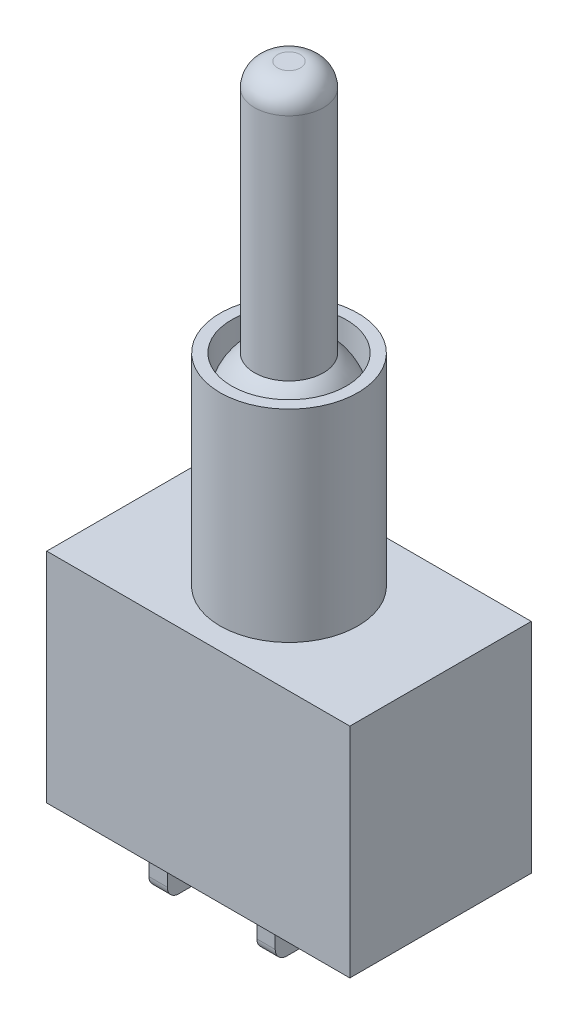
from build123d import *

# Parameters (mm, degrees)
SKETCH1_W           = 13.2
SKETCH1_H           = 7.9
BOSS_EXTRUDE1_DEPTH = 9.5
SKETCH2_R           = 3
BOSS_EXTRUDE2_DEPTH = 8.8
SKETCH4_R           = 2.5
CUT_EXTRUDE1_DEPTH  = 2
SKETCH5_R           = 1.5
BOSS_EXTRUDE3_DEPTH = 13
REVOLVE2_ANGLE      = 180
FILLET1_R           = 1
SKETCH6_W           = 0.8
SKETCH6_H           = 2
BOSS_EXTRUDE4_DEPTH = 4
SKETCH7_W           = 1
SKETCH7_H           = 2
CUT_EXTRUDE3_DEPTH  = 32.795951
FILLET3_R           = 0.5


with BuildPart() as part:
    # Sketch1 → Boss-Extrude1 (new body)
    with BuildSketch(Plane(origin=(0, 0, 0), x_dir=(1, 0, 0), z_dir=(0, 1, 0))):
        Rectangle(SKETCH1_W, SKETCH1_H)
    extrude(amount=BOSS_EXTRUDE1_DEPTH)

    # Sketch2 → Boss-Extrude2 (add)
    with BuildSketch(Plane(origin=(0, 9.5, 0), x_dir=(1, 0, 0), z_dir=(0, 1, 0))):
        with Locations(Location((0, 0, 0), (0, 0, 270))):
            Circle(SKETCH2_R)
    extrude(amount=BOSS_EXTRUDE2_DEPTH)

    # Sketch4 → Cut-Extrude1 (cut)
    with BuildSketch(Plane(origin=(0, 18.3, 0), x_dir=(1, 0, 0), z_dir=(0, 1, 0))):
        with Locations(Location((0, 0, 0), (0, 0, 270))):
            Circle(SKETCH4_R)
    extrude(amount=-CUT_EXTRUDE1_DEPTH, mode=Mode.SUBTRACT)

    # Sketch5 → Boss-Extrude3 (add)
    with BuildSketch(Plane(origin=(0, 16.3, 0), x_dir=(1, 0, 0), z_dir=(0, 1, 0))):
        with Locations(Location((0, 0, 0), (0, 0, 90))):
            Circle(SKETCH5_R)
    extrude(amount=BOSS_EXTRUDE3_DEPTH)

    # Sketch3 → Revolve2 (revolve)
    with BuildSketch(Plane(origin=(0, 16.3, 0), x_dir=(1, 0, 0), z_dir=(0, 1, 0))):
        with BuildLine():
            Line((0, -2.5), (0, 2.5))
            ThreePointArc((0, 2.5), (-2.5, 0), (0, -2.5))
        make_face()
    revolve(axis=Axis((0, 16.3, 3), (0, 0, -1)), revolution_arc=REVOLVE2_ANGLE)

    # Fillet1
    fillet1_edges = [part.edges().sort_by_distance(p)[0] for p in [
        (0, 29.3, 1.5),
    ]]
    fillet(fillet1_edges, radius=FILLET1_R)

    # Sketch6 → Boss-Extrude4 (add)
    with BuildSketch(Plane.XZ):
        with Locations((-4.7, 0)):
            Rectangle(SKETCH6_W, SKETCH6_H)
        Rectangle(SKETCH6_W, SKETCH6_H)
    extrude(amount=BOSS_EXTRUDE4_DEPTH)

    # Sketch7 → Cut-Extrude3 (cut, through all)
    with BuildSketch(Plane.ZY.offset(5.1)):
        with Locations((0, -2.5)):
            Rectangle(SKETCH7_W, SKETCH7_H)
    extrude(amount=-CUT_EXTRUDE3_DEPTH, mode=Mode.SUBTRACT)

    # Fillet3
    fillet3_edges = [part.edges().sort_by_distance(p)[0] for p in [
        (0, -4, 1),
        (0, -4, -1),
        (-4.7, -4, -1),
        (-4.7, -4, 1),
        (0, -3.5, -0.5),
        (0, -1.5, -0.5),
        (0, -3.5, 0.5),
        (0, -1.5, 0.5),
        (-4.7, -1.5, 0.5),
        (-4.7, -1.5, -0.5),
        (-4.7, -3.5, 0.5),
        (-4.7, -3.5, -0.5),
    ]]
    fillet(fillet3_edges, radius=FILLET3_R - 0.0001)  # a hair under: the kernel refuses the full size


solid = part.part
